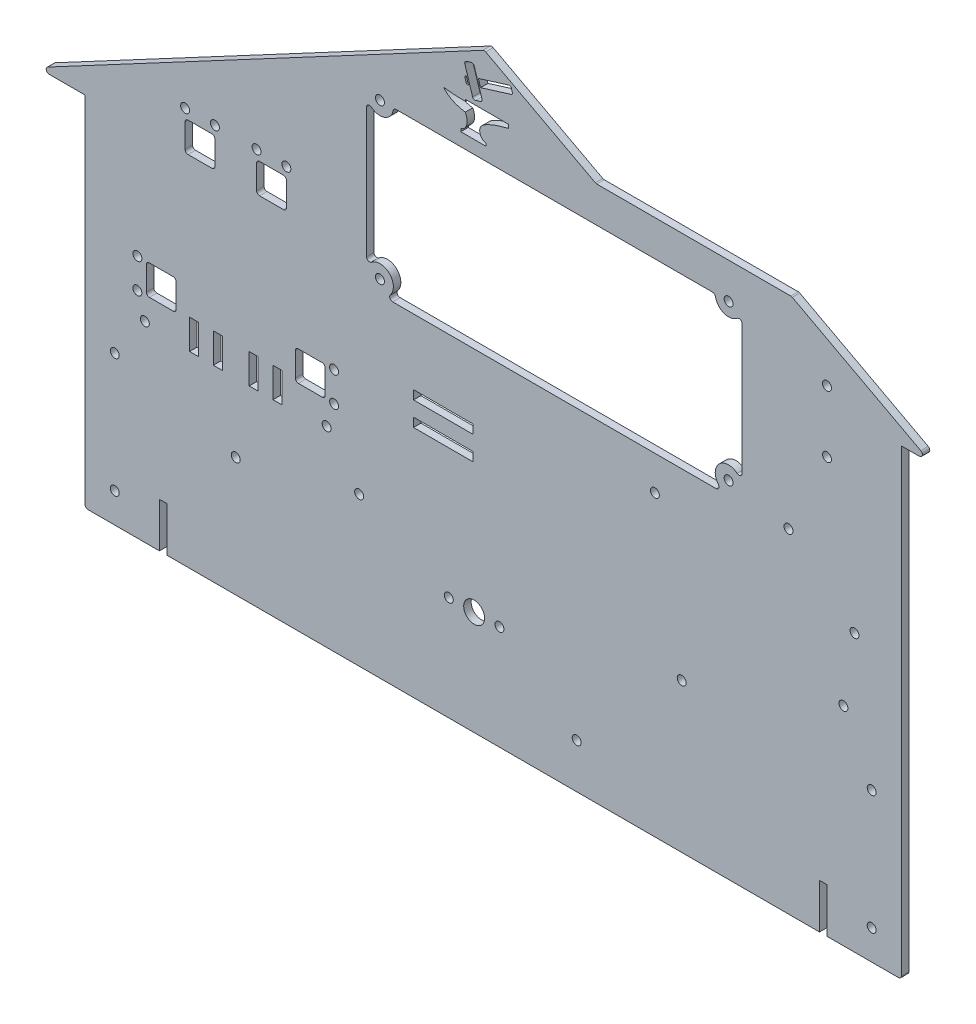
from build123d import *

# Parameters (mm, degrees)
SKETCH_1_W           = 300
SKETCH_1_H           = 200
SKETCH_1_R           = 1.5
EXTRUDE_1_DEPTH      = 2.5
SKETCH_2_R           = 1.5
CUT_EXTRUDE_1_DEPTH  = 318.657441279
SKETCH_3_R           = 3.5
SKETCH_3_R_2         = 1.5
CUT_EXTRUDE_2_DEPTH  = 318.657441279
SKETCH_4_W           = 3
SKETCH_4_H           = 10
CUT_EXTRUDE_3_DEPTH  = 318.657441279
SKETCH_5_R           = 1.5
SKETCH_5_W           = 20
SKETCH_5_H           = 3
CUT_EXTRUDE_4_DEPTH  = 318.657441279
SKETCH_6_W           = 16
SKETCH_6_H           = 120
CUT_EXTRUDE_5_DEPTH  = 318.657441279
SKETCH_7_R           = 1.5
CUT_EXTRUDE_6_DEPTH  = 318.657441279
SKETCH_8_R           = 1.5
CUT_EXTRUDE_7_DEPTH  = 318.657441279
SKETCH_10_R          = 1.5
CUT_EXTRUDE_9_DEPTH  = 318.657441279
SKETCH_11_R          = 1.5
CUT_EXTRUDE_14_DEPTH = 318.657441279
SKETCH_13_R          = 1.5
CUT_EXTRUDE_12_DEPTH = 318.657441279
CUT_EXTRUDE_13_DEPTH = 318.657441279
SKETCH_16_W          = 10
SKETCH_16_H          = 155
CUT_EXTRUDE_16_DEPTH = 318.657441415
FILLET_1_R           = 1
CUT_EXTRUDE_15_DEPTH = 315.952802597
SKETCH_9_W           = 2.5
SKETCH_9_H           = 15
CUT_EXTRUDE_8_DEPTH  = 315.952802597
FILLET_2_R           = 1


with BuildPart() as part:
    # 草图1 → 凸台-拉伸1 (new body)
    with BuildSketch(Plane.XY):
        with Locations((-130, 50)):
            Rectangle(SKETCH_1_W, SKETCH_1_H)
        with Locations((-9.48275115, 19.751663277)):
            Circle(SKETCH_1_R, mode=Mode.SUBTRACT)
        with Locations((-27.916084483, 61.98499661)):
            Circle(SKETCH_1_R, mode=Mode.SUBTRACT)
        with Locations((-5.749417816, 42.751663277)):
            Circle(SKETCH_1_R, mode=Mode.SUBTRACT)
    extrude(amount=EXTRUDE_1_DEPTH)

    # 草图2 → 切除-拉伸1 (cut, through all)
    with BuildSketch(Plane.XY.offset(2.5)):
        with Locations((-63.75, 0)):
            Circle(SKETCH_2_R)
    extrude(amount=-CUT_EXTRUDE_1_DEPTH, mode=Mode.SUBTRACT)

    # 草图3 → 切除-拉伸2 (cut, through all)
    with BuildSketch(Plane.XY.offset(2.5)):
        with Locations((-133.403158579, -15)):
            Circle(SKETCH_3_R)
        with Locations((-213.403158579, -10)):
            Circle(SKETCH_3_R_2)
    extrude(amount=-CUT_EXTRUDE_2_DEPTH, mode=Mode.SUBTRACT)

    # 草图4 → 切除-拉伸3 (cut, through all)
    with BuildSketch(Plane.XY.offset(2.5)):
        with Locations((-219.403158579, 18)):
            Rectangle(SKETCH_4_W, SKETCH_4_H)
        with Locations((-227.403158579, 18)):
            Rectangle(SKETCH_4_W, SKETCH_4_H)
        with Locations((-207.403158579, 18)):
            Rectangle(SKETCH_4_W, SKETCH_4_H)
        with Locations((-199.403158579, 18)):
            Rectangle(SKETCH_4_W, SKETCH_4_H)
    extrude(amount=-CUT_EXTRUDE_3_DEPTH, mode=Mode.SUBTRACT)

    # 草图5 → 切除-拉伸4 (cut, through all)
    with BuildSketch(Plane.XY.offset(2.5)):
        with Locations((-72.75, 50)):
            Circle(SKETCH_5_R)
        with Locations((-143.75, 30)):
            Rectangle(SKETCH_5_W, SKETCH_5_H)
        with Locations((-143.75, 38)):
            Rectangle(SKETCH_5_W, SKETCH_5_H)
    extrude(amount=-CUT_EXTRUDE_4_DEPTH, mode=Mode.SUBTRACT)

    # 草图6 → 切除-拉伸5 (cut, through all)
    with BuildSketch(Plane.XY.offset(2.5)):
        Polygon((-280, 150), (-280, 70), (-130, 150), align=None)
        with Locations((-272, 10)):
            Rectangle(SKETCH_6_W, SKETCH_6_H)
        Polygon((20, 150), (-130, 150), (-92.5, 130), (20, 130), align=None)
    extrude(amount=-CUT_EXTRUDE_5_DEPTH, mode=Mode.SUBTRACT)

    # 草图7 → 切除-拉伸6 (cut, through all)
    with BuildSketch(Plane.XY.offset(2.5)):
        with Locations((-141.903158579, -15)):
            Circle(SKETCH_7_R)
        with Locations((-124.903158579, -15)):
            Circle(SKETCH_7_R)
    extrude(amount=-CUT_EXTRUDE_6_DEPTH, mode=Mode.SUBTRACT)

    # 草图8 → 切除-拉伸7 (cut, through all)
    with BuildSketch(Plane.XY.offset(2.5)):
        with Locations((-254, 0)):
            Circle(SKETCH_8_R)
        with Locations((-254, -40)):
            Circle(SKETCH_8_R)
        with Locations((-172, 0)):
            Circle(SKETCH_8_R)
        with Locations((-99, -35)):
            Circle(SKETCH_8_R)
        with Locations((0, -40)):
            Circle(SKETCH_8_R)
        Circle(SKETCH_8_R)
    extrude(amount=-CUT_EXTRUDE_7_DEPTH, mode=Mode.SUBTRACT)

    # 草图10 → 切除-拉伸9 (cut, through all)
    with BuildSketch(Plane.XY.offset(2.5)):
        with Locations((-15, 110)):
            Circle(SKETCH_10_R)
        with Locations((-15, 89.3)):
            Circle(SKETCH_10_R)
    extrude(amount=-CUT_EXTRUDE_9_DEPTH, mode=Mode.SUBTRACT)

    # 草图11 → 切除-拉伸14 (cut, through all)
    with BuildSketch(Plane.XY.offset(2.5)):
        with Locations((-243.903158579, 14.3)):
            Circle(SKETCH_11_R)
        with Locations((-182.903158579, 14.3)):
            Circle(SKETCH_11_R)
        with Locations((-180.403158579, 32)):
            Circle(SKETCH_11_R)
        with Locations((-180.403158579, 22)):
            Circle(SKETCH_11_R)
        with Locations((-206.403158579, 83)):
            Circle(SKETCH_11_R)
        with Locations((-196.403158579, 83)):
            Circle(SKETCH_11_R)
        with Locations((-246.403158579, 22)):
            Circle(SKETCH_11_R)
        with Locations((-246.403158579, 32)):
            Circle(SKETCH_11_R)
        with Locations((-230.403158579, 83)):
            Circle(SKETCH_11_R)
        with Locations((-220.403158579, 83)):
            Circle(SKETCH_11_R)
        with BuildLine():
            Line((-192.403158579, 32), (-184.403158579, 32))
            ThreePointArc((-184.403158579, 32), (-183.696051798, 31.707106781), (-183.403158579, 31))
            Line((-183.403158579, 31), (-183.403158579, 23))
            ThreePointArc((-183.403158579, 23), (-183.696051798, 22.292893219), (-184.403158579, 22))
            Line((-184.403158579, 22), (-192.403158579, 22))
            ThreePointArc((-192.403158579, 22), (-193.11026536, 22.292893219), (-193.403158579, 23))
            Line((-193.403158579, 23), (-193.403158579, 31))
            ThreePointArc((-193.403158579, 31), (-193.11026536, 31.707106781), (-192.403158579, 32))
        make_face()
        with BuildLine():
            Line((-205.403158579, 80), (-197.403158579, 80))
            ThreePointArc((-197.403158579, 80), (-196.696051798, 79.707106781), (-196.403158579, 79))
            Line((-196.403158579, 79), (-196.403158579, 71))
            ThreePointArc((-196.403158579, 71), (-196.696051798, 70.292893219), (-197.403158579, 70))
            Line((-197.403158579, 70), (-205.403158579, 70))
            ThreePointArc((-205.403158579, 70), (-206.11026536, 70.292893219), (-206.403158579, 71))
            Line((-206.403158579, 71), (-206.403158579, 79))
            ThreePointArc((-206.403158579, 79), (-206.11026536, 79.707106781), (-205.403158579, 80))
        make_face()
        with BuildLine():
            Line((-234.403158579, 22), (-242.403158579, 22))
            ThreePointArc((-242.403158579, 22), (-243.11026536, 22.292893219), (-243.403158579, 23))
            Line((-243.403158579, 23), (-243.403158579, 31))
            ThreePointArc((-243.403158579, 31), (-243.11026536, 31.707106781), (-242.403158579, 32))
            Line((-242.403158579, 32), (-234.403158579, 32))
            ThreePointArc((-234.403158579, 32), (-233.696051798, 31.707106781), (-233.403158579, 31))
            Line((-233.403158579, 31), (-233.403158579, 23))
            ThreePointArc((-233.403158579, 23), (-233.696051798, 22.292893219), (-234.403158579, 22))
        make_face()
        with BuildLine():
            Line((-220.403158579, 79), (-220.403158579, 71))
            ThreePointArc((-220.403158579, 71), (-220.696051798, 70.292893219), (-221.403158579, 70))
            Line((-221.403158579, 70), (-229.403158579, 70))
            ThreePointArc((-229.403158579, 70), (-230.11026536, 70.292893219), (-230.403158579, 71))
            Line((-230.403158579, 71), (-230.403158579, 79))
            ThreePointArc((-230.403158579, 79), (-230.11026536, 79.707106781), (-229.403158579, 80))
            Line((-229.403158579, 80), (-221.403158579, 80))
            ThreePointArc((-221.403158579, 80), (-220.696051798, 79.707106781), (-220.403158579, 79))
        make_face()
    extrude(amount=-CUT_EXTRUDE_14_DEPTH, mode=Mode.SUBTRACT)

    # 草图13 → 切除-拉伸12 (cut, through all)
    with BuildSketch(Plane.XY.offset(2.5)):
        with Locations((-165, 118)):
            Circle(SKETCH_13_R)
        with Locations((-48, 118)):
            Circle(SKETCH_13_R)
        with Locations((-48, 66)):
            Circle(SKETCH_13_R)
        with Locations((-165, 66)):
            Circle(SKETCH_13_R)
    extrude(amount=-CUT_EXTRUDE_12_DEPTH, mode=Mode.SUBTRACT)

    # 草图14 → 切除-拉伸13 (cut, through all)
    with BuildSketch(Plane.XY.offset(2.5)):
        with BuildLine():
            Line((-136.23340536, 132.554425289), (-121.947229933, 132.554425289))
            Line((-121.947229933, 132.554425289), (-121.947229933, 131.33572932))
            add(Edge.make_bspline(
                [(-129.370454131, 123.29808375), (-130.381634675, 123.333140217), (-131.652650876, 124.64710811), (-131.531045324, 127.317124348), (-127.818484888, 129.800076585), (-124.595886665, 130.622870784), (-121.947229933, 131.33572932)],
                knots=[0, 0, 0, 0, 0.185055386, 0.315033601, 0.470626499, 1, 1, 1, 1], degree=3))
            Line((-129.370454131, 123.29808375), (-129.370454131, 122.382711026))
            Line((-129.370454131, 122.382711026), (-137.874932274, 122.382711026))
            Line((-137.874932274, 122.382711026), (-137.874932274, 123.29808375))
            add(Edge.make_bspline(
                [(-136.366849009, 128.823058673), (-135.369206348, 127.027961084), (-135.479246783, 124.001267012), (-137.874932274, 123.29808375)],
                knots=[0, 0, 0, 0, 1, 1, 1, 1], degree=3))
            add(Edge.make_bspline(
                [(-143.607042199, 132.420157238), (-141.906616206, 130.162899693), (-139.031400698, 129.284453677), (-136.366849009, 128.823058673)],
                knots=[0, 0, 0, 0, 1, 1, 1, 1], degree=3))
            add(Edge.make_bspline(
                [(-136.23340536, 131.9599561), (-139.935973212, 131.925366861), (-143.607042199, 132.420157238)],
                knots=[0, 0, 0, 1, 1, 1], degree=2))
            Line((-136.23340536, 131.9599561), (-136.23340536, 132.554425289))
        make_face()
        with BuildLine():
            Line((-136.527606543, 142.774022756), (-133.918401846, 134.498682701))
            ThreePointArc((-133.918401846, 134.498682701), (-133.524827176, 134.029638674), (-132.914863646, 133.97627378))
            Line((-132.914863646, 133.97627378), (-131.294430208, 134.487194481))
            ThreePointArc((-131.294430208, 134.487194481), (-130.825386181, 134.880769151), (-130.772021287, 135.490732681))
            Line((-130.772021287, 135.490732681), (-133.381225983, 143.766072736))
            ThreePointArc((-133.381225983, 143.766072736), (-133.774800653, 144.235116763), (-134.384764184, 144.288481657))
            Line((-134.384764184, 144.288481657), (-136.005197622, 143.777560956))
            ThreePointArc((-136.005197622, 143.777560956), (-136.474241649, 143.383986286), (-136.527606543, 142.774022756))
        make_face()
        with BuildLine():
            Line((-135.47047048, 137.187733333), (-135.292492303, 137.243015155))
            Line((-135.292492303, 137.243015155), (-136.013244755, 139.563456186))
            Line((-136.013244755, 139.563456186), (-136.191222931, 139.508174365))
            ThreePointArc((-136.191222931, 139.508174365), (-136.485423229, 139.263444321), (-136.52040398, 138.882363022))
            Line((-136.52040398, 138.882363022), (-136.096281823, 137.516914382))
            ThreePointArc((-136.096281823, 137.516914382), (-135.851551779, 137.222714085), (-135.47047048, 137.187733333))
        make_face()
        with BuildLine():
            Line((-120.541203468, 142.348479029), (-120.965325624, 143.713927669))
            ThreePointArc((-120.965325624, 143.713927669), (-121.210055668, 144.008127966), (-121.591136967, 144.043108717))
            Line((-121.591136967, 144.043108717), (-131.978852184, 140.816579319))
            Line((-131.978852184, 140.816579319), (-131.258099732, 138.496138288))
            Line((-131.258099732, 138.496138288), (-120.870384516, 141.722667686))
            ThreePointArc((-120.870384516, 141.722667686), (-120.576184219, 141.96739773), (-120.541203468, 142.348479029))
        make_face()
    extrude(amount=-CUT_EXTRUDE_13_DEPTH, mode=Mode.SUBTRACT)

    # 草图16 → 切除-拉伸16 (cut, through all)
    with BuildSketch(Plane.XY.offset(2.5)):
        Polygon((20, 130), (-26.875, 130), (20, 105), align=None)
        with Locations((15, 27.5)):
            Rectangle(SKETCH_16_W, SKETCH_16_H)
    extrude(amount=-CUT_EXTRUDE_16_DEPTH, mode=Mode.SUBTRACT)

    # 圆角1
    fillet_1_edges = [part.edges().sort_by_distance(p)[0] for p in [
        (-92.5, 130, 1.25),
        (-130, 150, 1.25),
        (-280, 70, 1.25),
        (-264, -50, 1.25),
        (-26.875, 130, 1.25),
        (10, -50, 1.25),
        (20, 105, 1.25),
    ]]
    fillet(fillet_1_edges, radius=FILLET_1_R)

    # 草图15 → 切除-拉伸15 (cut, through all)
    with BuildSketch(Plane.XY.offset(2.5)):
        with BuildLine():
            Line((-160.5, 118), (-52.5, 118))
            ThreePointArc((-52.5, 118), (-48, 113.5), (-43.5, 118))
            Line((-43.5, 118), (-43.5, 66))
            ThreePointArc((-43.5, 66), (-51.181980515, 69.181980515), (-48, 61.5))
            Line((-48, 61.5), (-165, 61.5))
            ThreePointArc((-165, 61.5), (-161.818019485, 69.181980515), (-169.5, 66))
            Line((-169.5, 66), (-169.5, 118))
            ThreePointArc((-169.5, 118), (-165, 113.5), (-160.5, 118))
        make_face()
    extrude(amount=-CUT_EXTRUDE_15_DEPTH, mode=Mode.SUBTRACT)

    # 草图9 → 切除-拉伸8 (cut, through all)
    with BuildSketch(Plane.XY.offset(2.5)):
        with Locations((-237.75, -42.5)):
            Rectangle(SKETCH_9_W, SKETCH_9_H)
        with Locations((-16.25, -42.5)):
            Rectangle(SKETCH_9_W, SKETCH_9_H)
    extrude(amount=-CUT_EXTRUDE_8_DEPTH, mode=Mode.SUBTRACT)

    # 圆角2
    fillet_2_edges = [part.edges().sort_by_distance(p)[0] for p in [
        (-52.5, 118, 1.25),
    ]]
    fillet(fillet_2_edges, radius=FILLET_2_R)
    fillet_2_2_edges = [part.edges().sort_by_distance(p)[0] for p in [
        (-160.5, 118, 1.25),
    ]]
    fillet(fillet_2_2_edges, radius=FILLET_2_R)
    fillet_2_3_edges = [part.edges().sort_by_distance(p)[0] for p in [
        (-169.5, 118, 1.25),
    ]]
    fillet(fillet_2_3_edges, radius=FILLET_2_R)
    fillet_2_4_edges = [part.edges().sort_by_distance(p)[0] for p in [
        (-43.5, 118, 1.25),
    ]]
    fillet(fillet_2_4_edges, radius=FILLET_2_R)
    fillet_2_5_edges = [part.edges().sort_by_distance(p)[0] for p in [
        (-169.5, 66, 1.25),
    ]]
    fillet(fillet_2_5_edges, radius=FILLET_2_R)
    fillet_2_6_edges = [part.edges().sort_by_distance(p)[0] for p in [
        (-43.5, 66, 1.25),
    ]]
    fillet(fillet_2_6_edges, radius=FILLET_2_R)
    fillet_2_7_edges = [part.edges().sort_by_distance(p)[0] for p in [
        (-165, 61.5, 1.25),
    ]]
    fillet(fillet_2_7_edges, radius=FILLET_2_R)
    fillet_2_8_edges = [part.edges().sort_by_distance(p)[0] for p in [
        (-48, 61.5, 1.25),
    ]]
    fillet(fillet_2_8_edges, radius=FILLET_2_R)


solid = part.part
